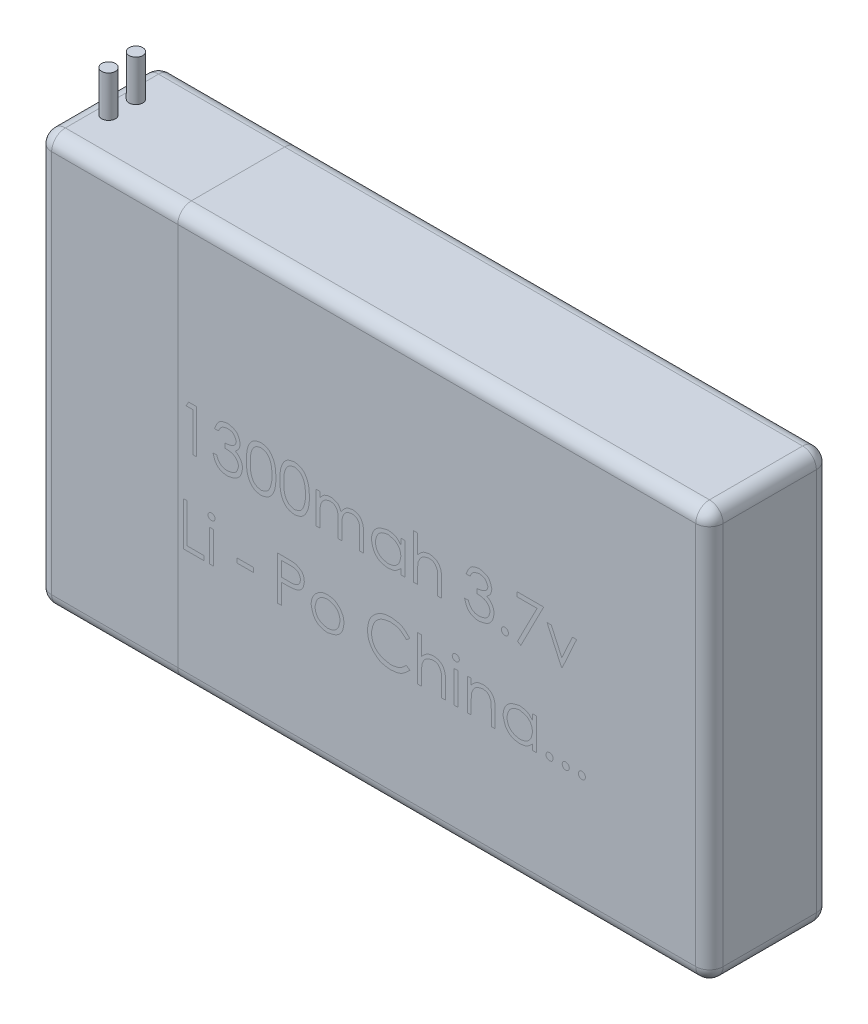
from build123d import *

# Parameters (mm, degrees)
SKETCH1_W           = 49
SKETCH1_H           = 30
BOSS_EXTRUDE1_DEPTH = 4.4
FILLET1_R           = 1
SKETCH3_R           = 0.5
BOSS_EXTRUDE2_DEPTH = 3


with BuildPart() as part:
    # Sketch1 → Boss-Extrude1 (new, symmetric)
    with BuildSketch(Plane.XY):
        Rectangle(SKETCH1_W, SKETCH1_H)
    extrude(amount=BOSS_EXTRUDE1_DEPTH, both=True)

    # Fillet1
    fillet1_edges = [part.edges().sort_by_distance(p)[0] for p in [
        (24.5, 15, 0),
        (-24.5, 15, 0),
        (-24.5, -15, 0),
        (24.5, -15, 0),
        (0, -15, 4.4),
        (-24.5, 0, 4.4),
        (0, 15, 4.4),
        (24.5, 0, 4.4),
        (0, -15, -4.4),
        (-24.5, 0, -4.4),
        (0, 15, -4.4),
        (24.5, 0, -4.4),
    ]]
    fillet(fillet1_edges, radius=FILLET1_R)

    # Sketch3 → Boss-Extrude2 (add)
    with BuildSketch(Plane(origin=(0, 15, 0), x_dir=(1, 0, 0), z_dir=(0, 1, 0))):
        with Locations((-22.75, 1)):
            Circle(SKETCH3_R)
        with Locations((-22.75, -1)):
            Circle(SKETCH3_R)
    extrude(amount=BOSS_EXTRUDE2_DEPTH)


solid = part.part
